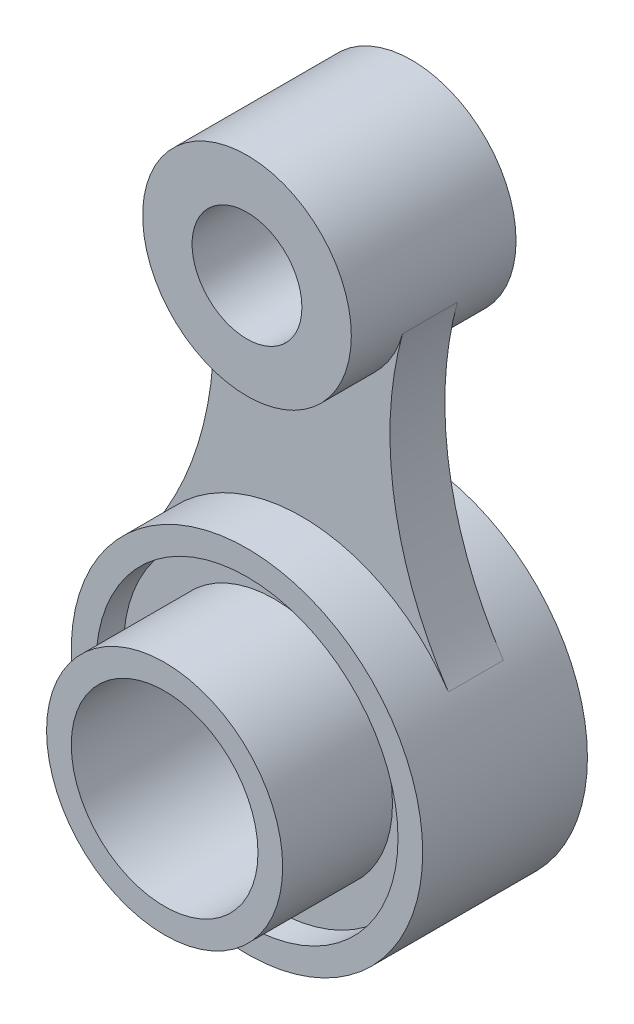
from build123d import *

# Parameters (mm, degrees)
BOSS_EXTRU_1_DEPTH      = 5
ESQUISSE1_3_R           = 19
ESQUISSE1_3_R_2         = 10
BOSS_EXTRU_2_DEPTH      = 15
ESQUISSE1_4_R           = 32
ESQUISSE1_4_R_2         = 17
BOSS_EXTRU_3_DEPTH      = 15
BOSS_EXTRU_4_DEPTH      = 30
BOSS_EXTRU_4_DEPTH_BACK = 15
ESQUISSE1_5_R           = 21.5
ESQUISSE1_5_R_2         = 17
ENL_V_START             = 10
ESQUISSE1_6_R           = 27.5
ESQUISSE1_6_R_2         = 21.5
ENL_V_MAT_EXTRU_1_DEPTH = 5


with BuildPart() as part:
    # Esquisse1 → Boss.-Extru.1 (new, symmetric)
    with BuildSketch(Plane.XY):
        with BuildLine():
            ThreePointArc((-26.678302647, 17.671111111), (0, 32), (26.678302647, 17.671111111))
            ThreePointArc((26.678302647, 17.671111111), (16.836772686, 42.914041255), (18.321243986, 69.966907631))
            ThreePointArc((18.321243986, 69.966907631), (0, 56), (-18.321243986, 69.966907631))
            ThreePointArc((-18.321243986, 69.966907631), (-16.836772686, 42.914041255), (-26.678302647, 17.671111111))
        make_face()
    extrude(amount=BOSS_EXTRU_1_DEPTH, both=True)

    # Esquisse1<3> → Boss.-Extru.2 (add, symmetric)
    with BuildSketch(Plane.XY):
        with Locations((0, 75)):
            Circle(ESQUISSE1_3_R)
        with Locations((0, 75)):
            Circle(ESQUISSE1_3_R_2, mode=Mode.SUBTRACT)
    extrude(amount=BOSS_EXTRU_2_DEPTH, both=True)

    # Esquisse1<4> → Boss.-Extru.3 (add, symmetric)
    with BuildSketch(Plane.XY):
        Circle(ESQUISSE1_4_R)
        Circle(ESQUISSE1_4_R_2, mode=Mode.SUBTRACT)
    extrude(amount=BOSS_EXTRU_3_DEPTH, both=True)

    # Esquisse1<5> → Boss.-Extru.4 (add, two sides: drawn at the far end of the back side and taken through both)
    with BuildSketch(Plane.XY.offset(-BOSS_EXTRU_4_DEPTH_BACK)):
        Circle(ESQUISSE1_5_R)
        Circle(ESQUISSE1_5_R_2, mode=Mode.SUBTRACT)
    extrude(amount=BOSS_EXTRU_4_DEPTH + BOSS_EXTRU_4_DEPTH_BACK)

    # Esquisse1<6> → Enlèv. mat.-Extru.1 (cut)
    with BuildSketch(Plane.XY.offset(ENL_V_START)):
        Circle(ESQUISSE1_6_R)
        Circle(ESQUISSE1_6_R_2, mode=Mode.SUBTRACT)
    extrude(amount=ENL_V_MAT_EXTRU_1_DEPTH, mode=Mode.SUBTRACT)


solid = part.part
